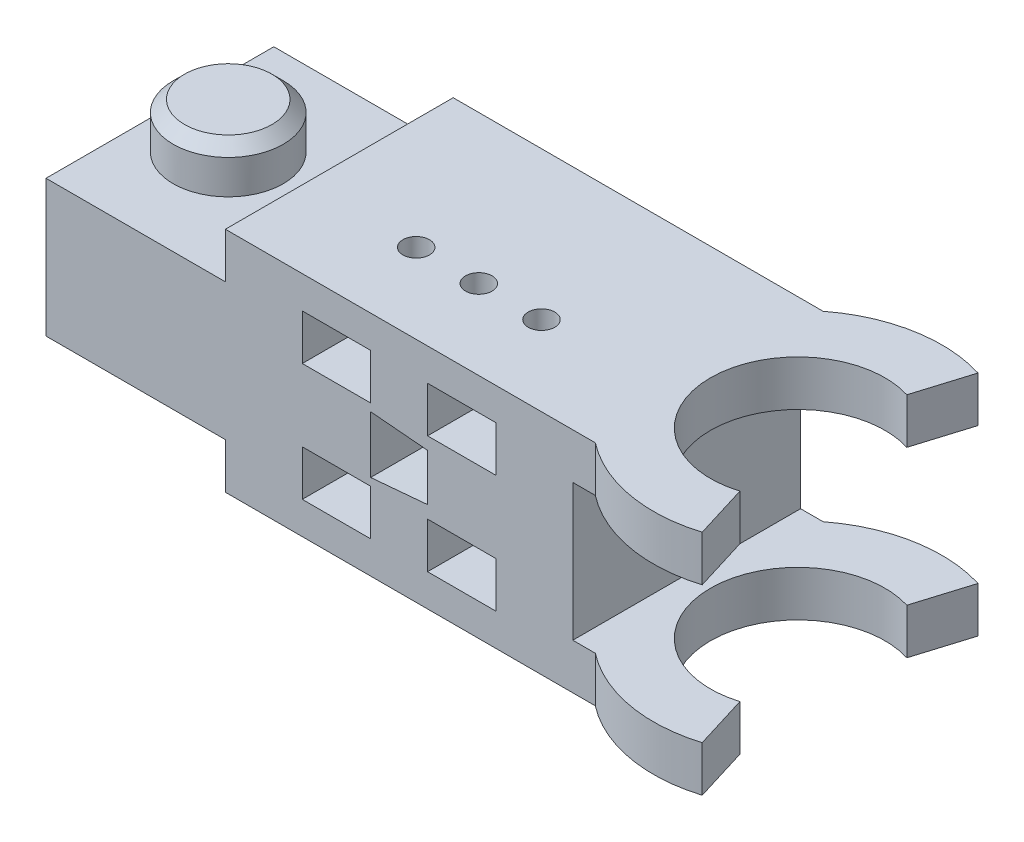
from build123d import *

# Parameters (mm, degrees)
BOSS_EXTRUDE1_DEPTH = 20
SKETCH2_R           = 4.835
BOSS_EXTRUDE2_DEPTH = 4
CUT_EXTRUDE1_REACH  = 64.738
SKETCH3_R           = 7.665
CUT_EXTRUDE2_DEPTH  = 10
SKETCH5_W           = 6
SKETCH5_H           = 4
CUT_EXTRUDE3_DEPTH  = 10
CUT_EXTRUDE4_REACH  = 64.738
SKETCH6_R           = 1.165
BOSS_EXTRUDE4_DEPTH = 4
BOSS_EXTRUDE5_START = -4
BOSS_EXTRUDE5_DEPTH = 4
CHAMFER1_SIZE       = 3
CHAMFER2_SIZE       = 1
CHAMFER3_SIZE       = 1


with BuildPart() as part:
    # Sketch1 → Boss-Extrude1 (new body)
    with BuildSketch(Plane.XY):
        Polygon((-40.25, -10), (-40.25, -6), (-50, -6), (-56, -6), (-56, 6), (-50, 6), (-40.25, 6), (-40.25, 10), (0, 10), (2.25, 10), (2.25, 6), (0, 6), (-9.75, 6), (-9.75, -6), (0, -6), (2.25, -6), (2.25, -10), (0, -10), align=None)
    extrude(amount=BOSS_EXTRUDE1_DEPTH)

    # Sketch2 → Boss-Extrude2 (add)
    with BuildSketch(Plane.XZ.offset(6)):
        with Locations(Location((-50, 10, 0), (0, 0, 180))):
            Circle(SKETCH2_R)
    boss_extrude2 = extrude(amount=BOSS_EXTRUDE2_DEPTH)

    # Cut-Extrude1: up to this face of the body (flat: up to its plane)
    cut_extrude1_end = Plane(part.part.faces().sort_by_distance((-19, 10, 10))[0])
    # Sketch3 → Cut-Extrude1 (cut, up to the picked face)
    with BuildSketch(Plane.XZ.offset(10), mode=Mode.PRIVATE) as cut_extrude1_sk1:
        with Locations((0, 10)):
            Circle(SKETCH3_R)
    cut_extrude1_tool1 = split(extrude(cut_extrude1_sk1.sketch, amount=-CUT_EXTRUDE1_REACH, mode=Mode.PRIVATE), bisect_by=cut_extrude1_end, keep=Keep.BOTH, mode=Mode.PRIVATE)
    add(cut_extrude1_tool1.solids().sort_by(Axis((0, -10, 10), (0, 1, 0)))[0], mode=Mode.SUBTRACT)

    # Mirror1: Boss-Extrude2 across plane
    add(boss_extrude2.mirror(Plane.ZX))

    # Sketch4 → Cut-Extrude2 (cut)
    with BuildSketch(Plane.XY.offset(20)):
        Polygon((-27.5, 2.5), (-22.5, 2.062556682), (-22.5, -2.062556682), (-27.5, -2.5), align=None)
    extrude(amount=-CUT_EXTRUDE2_DEPTH, mode=Mode.SUBTRACT)

    # Sketch5 → Cut-Extrude3 (cut)
    with BuildSketch(Plane.XY.offset(20)):
        with Locations((-30.5, 5.165)):
            Rectangle(SKETCH5_W, SKETCH5_H)
        with Locations((-19.5, 5.165)):
            Rectangle(SKETCH5_W, SKETCH5_H)
        with Locations((-19.5, -5.165)):
            Rectangle(SKETCH5_W, SKETCH5_H)
        with Locations((-30.5, -5.165)):
            Rectangle(SKETCH5_W, SKETCH5_H)
    extrude(amount=-CUT_EXTRUDE3_DEPTH, mode=Mode.SUBTRACT)

    # Cut-Extrude4: up to this face of the body (flat: up to its plane)
    cut_extrude4_end = Plane(part.part.faces().sort_by_distance((-21.952820108, 10, 10))[0])
    # Sketch6 → Cut-Extrude4 (cut, up to the picked face)
    with BuildSketch(Plane.XZ.offset(10), mode=Mode.PRIVATE) as cut_extrude4_sk1:
        with Locations(Location((-30.5, 13, 0), (0, 0, 270))):
            Circle(SKETCH6_R)
    cut_extrude4_tool1 = split(extrude(cut_extrude4_sk1.sketch, amount=-CUT_EXTRUDE4_REACH, mode=Mode.PRIVATE), bisect_by=cut_extrude4_end, keep=Keep.BOTH, mode=Mode.PRIVATE)
    # Sketch6 → Cut-Extrude4 (cut, up to the picked face)
    with BuildSketch(Plane.XZ.offset(10), mode=Mode.PRIVATE) as cut_extrude4_sk2:
        with Locations((-25, 13)):
            Circle(SKETCH6_R)
    cut_extrude4_tool2 = split(extrude(cut_extrude4_sk2.sketch, amount=-CUT_EXTRUDE4_REACH, mode=Mode.PRIVATE), bisect_by=cut_extrude4_end, keep=Keep.BOTH, mode=Mode.PRIVATE)
    # Sketch6 → Cut-Extrude4 (cut, up to the picked face)
    with BuildSketch(Plane.XZ.offset(10), mode=Mode.PRIVATE) as cut_extrude4_sk3:
        with Locations(Location((-19.5, 13, 0), (0, 0, 90))):
            Circle(SKETCH6_R)
    cut_extrude4_tool3 = split(extrude(cut_extrude4_sk3.sketch, amount=-CUT_EXTRUDE4_REACH, mode=Mode.PRIVATE), bisect_by=cut_extrude4_end, keep=Keep.BOTH, mode=Mode.PRIVATE)
    add(cut_extrude4_tool1.solids().sort_by(Axis((-30.5, -10, 13), (0, 1, 0)))[0], mode=Mode.SUBTRACT)
    add(cut_extrude4_tool2.solids().sort_by(Axis((-25, -10, 13), (0, 1, 0)))[0], mode=Mode.SUBTRACT)
    add(cut_extrude4_tool3.solids().sort_by(Axis((-19.5, -10, 13), (0, 1, 0)))[0], mode=Mode.SUBTRACT)

    # Sketch10 → Boss-Extrude4 (add)
    with BuildSketch(Plane.XZ.offset(10)):
        with BuildLine():
            Line((2.25, 17.327327275), (3.717710372, 22.107058049))
            ThreePointArc((3.717710372, 22.107058049), (-12.665, 10), (3.717710372, -2.107058049))
            Line((3.717710372, -2.107058049), (2.25, 2.672672725))
            ThreePointArc((2.25, 2.672672725), (-7.665, 10), (2.25, 17.327327275))
        make_face()
    extrude(amount=-BOSS_EXTRUDE4_DEPTH)

    # Sketch11 → Boss-Extrude5 (add)
    with BuildSketch(Plane(origin=(0, 10, 0), x_dir=(1, 0, 0), z_dir=(0, 1, 0)).offset(BOSS_EXTRUDE5_START)):
        with BuildLine():
            Line((-9.75, -20), (-7.771886837, -20))
            ThreePointArc((-7.771886837, -20), (-2.284515289, -22.457255512), (3.717710372, -22.107058049))
            Line((3.717710372, -22.107058049), (2.25, -17.327327275))
            ThreePointArc((2.25, -17.327327275), (-7.665, -10), (2.25, -2.672672725))
            Line((2.25, -2.672672725), (3.717710372, 2.107058049))
            ThreePointArc((3.717710372, 2.107058049), (-2.284515289, 2.457255512), (-7.771886837, 0))
            Line((-7.771886837, 0), (-9.75, 0))
            Line((-9.75, 0), (-9.75, -20))
        make_face()
    extrude(amount=BOSS_EXTRUDE5_DEPTH)

    # Chamfer1
    # the kernel refuses this chamfer: 3 mm, written as the material it takes off along each edge
    with BuildSketch(Plane(origin=(-30.5, -10, 13), x_dir=(0, 0, -1), z_dir=(-1, 0, 0))) as chamfer1_piece_1:
        Polygon((1.165, -CHAMFER1_SIZE), (1.165 + CHAMFER1_SIZE, 0), (1.165, 0), align=None)
    revolve(axis=Axis((-30.5, -10, 13), (0, -1, 0)), mode=Mode.SUBTRACT)
    with BuildSketch(Plane(origin=(-25, -10, 13), x_dir=(1, 0, 0), z_dir=(0, 0, -1))) as chamfer1_piece_2:
        Polygon((1.165, -CHAMFER1_SIZE), (1.165 + CHAMFER1_SIZE, 0), (1.165, 0), align=None)
    revolve(axis=Axis((-25, -10, 13), (0, -1, 0)), mode=Mode.SUBTRACT)
    with BuildSketch(Plane(origin=(-19.5, -10, 13), x_dir=(0, 0, 1), z_dir=(1, 0, 0))) as chamfer1_piece_3:
        Polygon((1.165, -CHAMFER1_SIZE), (1.165 + CHAMFER1_SIZE, 0), (1.165, 0), align=None)
    revolve(axis=Axis((-19.5, -10, 13), (0, -1, 0)), mode=Mode.SUBTRACT)

    # Chamfer2
    chamfer2_edges = [part.edges().sort_by_distance(p)[0] for p in [
        (-45.165, -10, 10),
    ]]
    chamfer(chamfer2_edges, length=CHAMFER2_SIZE)

    # Chamfer3
    chamfer3_edges = [part.edges().sort_by_distance(p)[0] for p in [
        (-45.165, 10, 10),
    ]]
    chamfer(chamfer3_edges, length=CHAMFER3_SIZE)


solid = part.part
